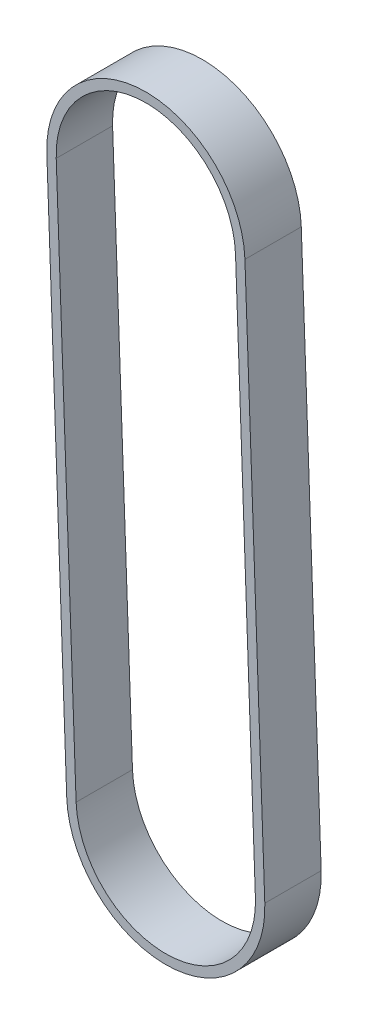
from build123d import *

# Parameters (mm, degrees)
EXTRUDE_THIN1_DEPTH = 9


with BuildPart() as part:
    # Sketch2 → Extrude-Thin1 (new body)
    with BuildSketch(Plane.XY):
        with BuildLine():
            Line((-12.611040877, -88.034452782), (-15.786040877, -0.592076973))
            ThreePointArc((-15.786040877, -0.592076973), (-0.546699905, 15.795630306), (15.841007374, 0.556289334))
            Line((15.841007374, 0.556289334), (19.016007374, -86.886086475))
            ThreePointArc((19.016007374, -86.886086475), (3.776666402, -103.273793754), (-12.611040877, -88.034452782))
        make_face()
        with BuildLine():
            Line((-11.112028692, -87.98002421), (-14.287028692, -0.537648401))
            ThreePointArc((-14.287028692, -0.537648401), (-0.492271333, 14.296618121), (14.341995189, 0.501860761))
            Line((14.341995189, 0.501860761), (17.516995189, -86.940515048))
            ThreePointArc((17.516995189, -86.940515048), (3.722237829, -101.774781569), (-11.112028692, -87.98002421))
        make_face(mode=Mode.SUBTRACT)
    extrude(amount=-EXTRUDE_THIN1_DEPTH)


solid = part.part
